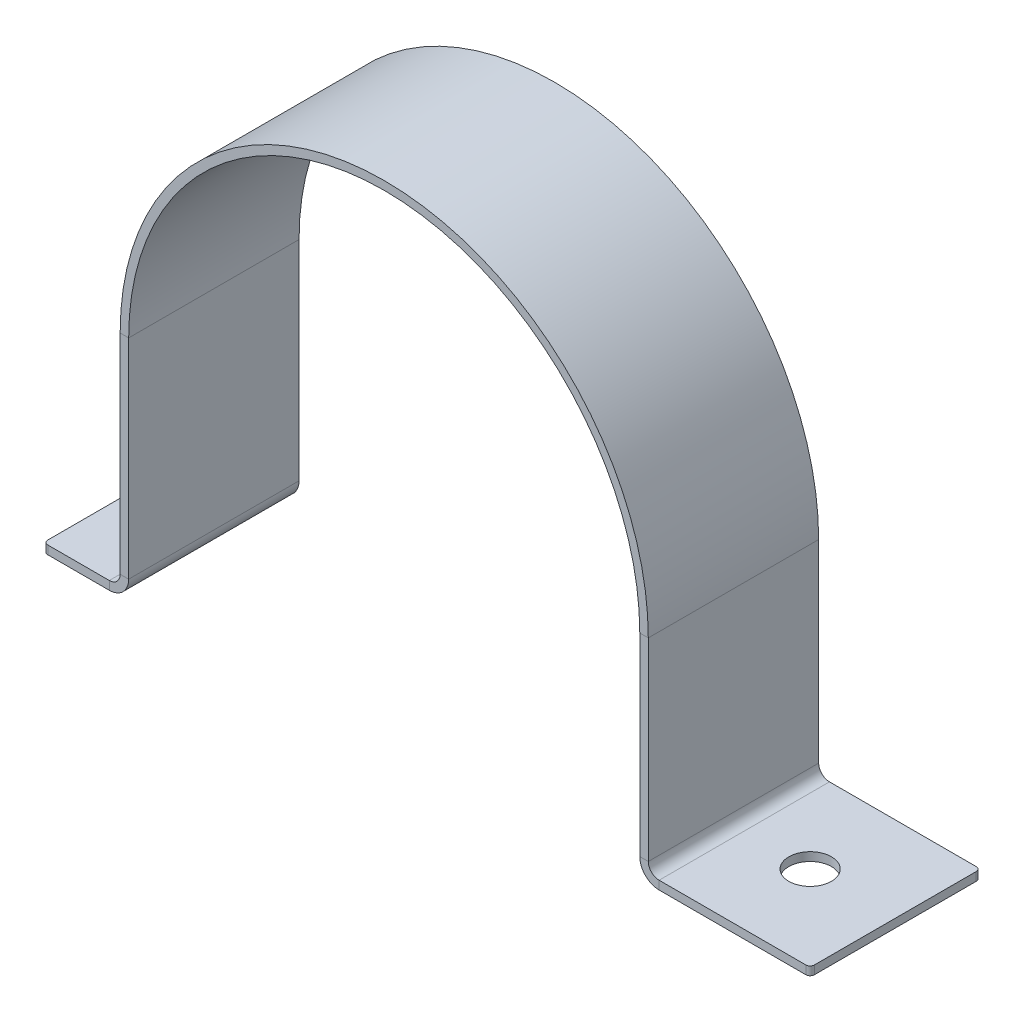
from build123d import *

# Parameters (mm, degrees)
BASE_FLANGE1_DEPTH = 20
SKETCH6_R          = 2.5
CUT_EXTRUDE1_DEPTH = 10
FILLET1_R          = 0.5


# Sheet-metal steps are written as plain solids
with BuildPart() as part:
    # Sketch1 → Base-Flange1 (new body)
    with BuildSketch(Plane.XY):
        with BuildLine():
            Line((50, -25), (32.27, -25))
            ThreePointArc((32.27, -25), (30.664867607, -24.335132393), (30, -22.73))
            Line((30, -22.73), (30, 0))
            ThreePointArc((30, 0), (0, 30), (-30, 0))
            Line((-30, 0), (-30, -24.53))
            ThreePointArc((-30, -24.53), (-30.664867607, -26.135132393), (-32.27, -26.8))
            Line((-32.27, -26.8), (-40, -26.8))
            Line((-40, -26.8), (-40, -25.8))
            Line((-40, -25.8), (-32.27, -25.8))
            ThreePointArc((-32.27, -25.8), (-31.371974388, -25.428025612), (-31, -24.53))
            Line((-31, -24.53), (-31, 0))
            ThreePointArc((-31, 0), (0, 31), (31, 0))
            Line((31, 0), (31, -22.73))
            ThreePointArc((31, -22.73), (31.371974388, -23.628025612), (32.27, -24))
            Line((32.27, -24), (50, -24))
            Line((50, -24), (50, -25))
        make_face()
    extrude(amount=BASE_FLANGE1_DEPTH)

    # Sketch6 → Cut-Extrude1 (cut)
    with BuildSketch(Plane(origin=(0, -24, 0), x_dir=(1, 0, 0), z_dir=(0, 1, 0))):
        with Locations(Location((40, -10, 0), (0, 0, 270))):
            Circle(SKETCH6_R)
    extrude(amount=-CUT_EXTRUDE1_DEPTH, mode=Mode.SUBTRACT)

    # Fillet1
    fillet1_edges = [part.edges().sort_by_distance(p)[0] for p in [
        (50, -24.5, 0),
        (-40, -26.3, 0),
        (50, -24.5, 20),
        (-40, -26.3, 20),
    ]]
    fillet(fillet1_edges, radius=FILLET1_R)


solid = part.part
